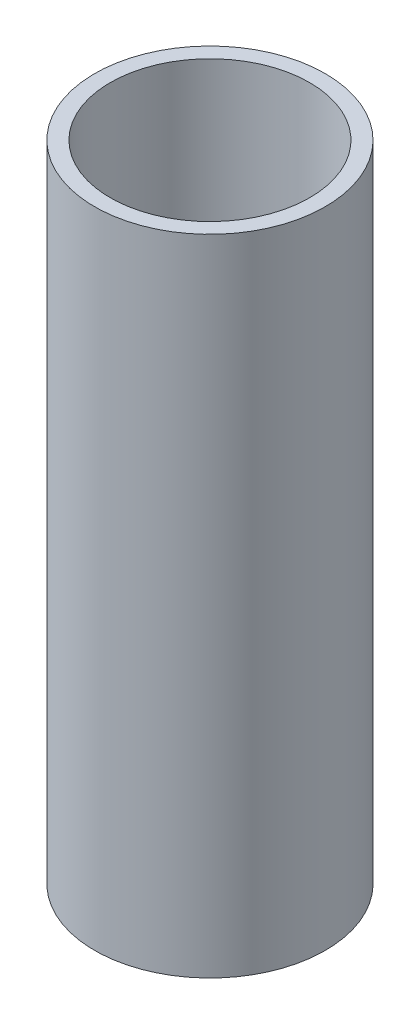
from build123d import *

# Parameters (mm, degrees)
SKETCH1_R           = 42.5
BOSS_EXTRUDE1_DEPTH = 237.349167838
SKETCH2_R           = 36.756013763
CUT_EXTRUDE1_DEPTH  = 245.841024899


with BuildPart() as part:
    # Sketch1 → Boss-Extrude1 (new body)
    with BuildSketch(Plane(origin=(0, 0, 0), x_dir=(1, 0, 0), z_dir=(0, 1, 0))):
        Circle(SKETCH1_R)
    extrude(amount=BOSS_EXTRUDE1_DEPTH)

    # Sketch2 → Cut-Extrude1 (cut, through all)
    with BuildSketch(Plane(origin=(0, 0, 0), x_dir=(1, 0, 0), z_dir=(0, 1, 0))):
        Circle(SKETCH2_R)
    extrude(amount=CUT_EXTRUDE1_DEPTH, mode=Mode.SUBTRACT)


solid = part.part
